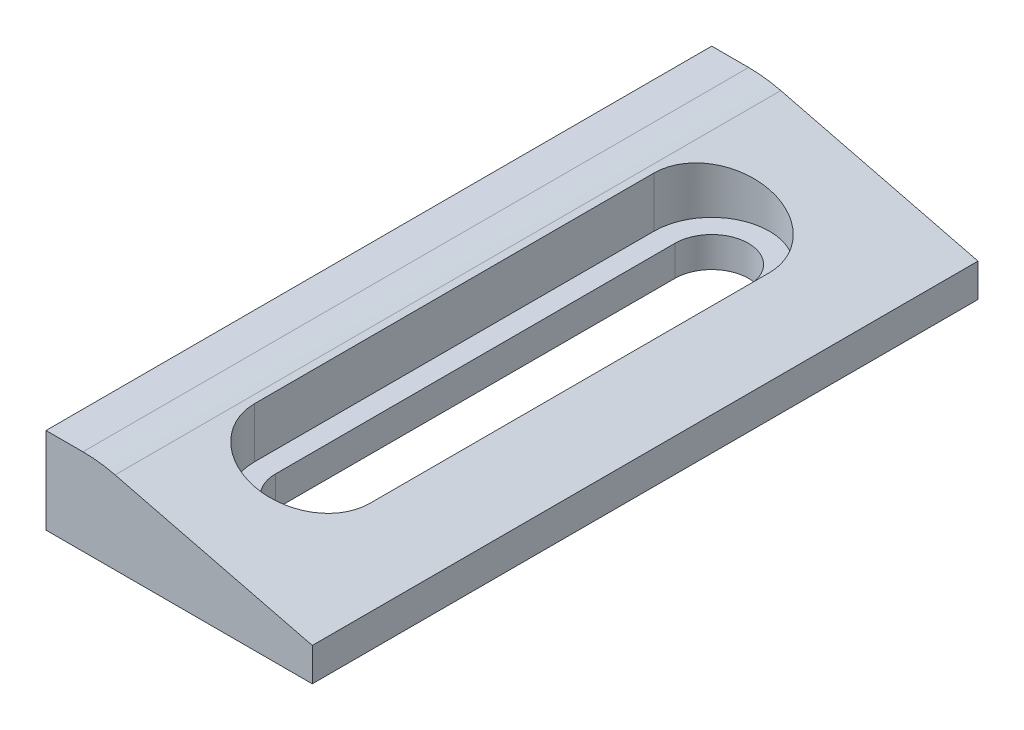
from build123d import *

# Parameters (mm, degrees)
BOSS_EXTRUDE1_DEPTH = 63.5
CUT_EXTRUDE1_DEPTH  = 5.334
CUT_EXTRUDE2_DEPTH  = 69.885253349


with BuildPart() as part:
    # Sketch1 → Boss-Extrude1 (new body)
    with BuildSketch(Plane.XY):
        with BuildLine():
            Line((6.59053704, 7.856205094), (25.4, 3.175))
            Line((25.4, 3.175), (25.4, 0))
            Line((25.4, 0), (0, 0))
            Line((0, 0), (0, 8.23214))
            Line((0, 8.23214), (3.523385339, 8.23214))
            ThreePointArc((3.523385339, 8.23214), (5.068437653, 8.137805922), (6.59053704, 7.856205094))
        make_face()
    extrude(amount=BOSS_EXTRUDE1_DEPTH)

    # Sketch2 → Cut-Extrude1 (cut)
    with BuildSketch(Plane(origin=(0, 8.23214, 0), x_dir=(1, 0, 0), z_dir=(0, 1, 0))):
        with BuildLine():
            Line((18.2, -12.7), (18.2, -50.8))
            ThreePointArc((18.2, -50.8), (12.7, -56.3), (7.2, -50.8))
            Line((7.2, -50.8), (7.2, -12.7))
            ThreePointArc((7.2, -12.7), (12.7, -7.2), (18.2, -12.7))
        make_face()
        with BuildLine():
            Line((16.2, -12.7), (16.2, -50.8))
            ThreePointArc((16.2, -50.8), (12.7, -54.3), (9.2, -50.8))
            Line((9.2, -50.8), (9.2, -12.7))
            ThreePointArc((9.2, -12.7), (12.7, -9.2), (16.2, -12.7))
        make_face(mode=Mode.SUBTRACT)
    extrude(amount=-CUT_EXTRUDE1_DEPTH, mode=Mode.SUBTRACT)

    # Sketch2<3> → Cut-Extrude2 (cut, through all)
    with BuildSketch(Plane(origin=(0, 8.23214, 0), x_dir=(1, 0, 0), z_dir=(0, 1, 0))):
        with BuildLine():
            Line((16.2, -50.8), (16.2, -12.7))
            ThreePointArc((16.2, -12.7), (12.7, -9.2), (9.2, -12.7))
            Line((9.2, -12.7), (9.2, -50.8))
            ThreePointArc((9.2, -50.8), (12.7, -54.3), (16.2, -50.8))
        make_face()
    extrude(amount=-CUT_EXTRUDE2_DEPTH, mode=Mode.SUBTRACT)


solid = part.part
